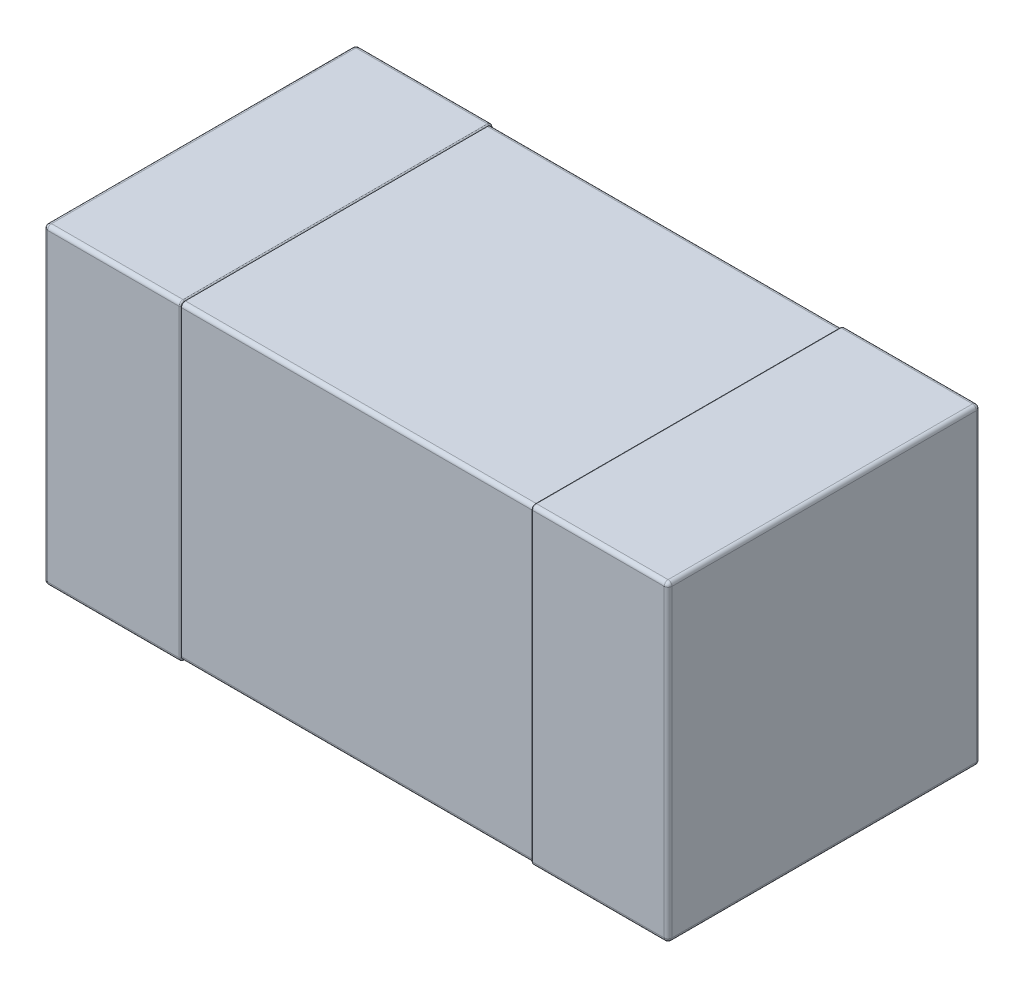
from build123d import *

# Parameters (mm, degrees)
SKETCH1_W                           = 1.6
SKETCH1_H                           = 0.8
ALL_BODY_DEPTH                      = 0.8
CUT_OUT_THE_BODY_FOR_PIN_DEPTH      = 0.45
CUT_OUT_THE_BODY_FOR_PIN_DEPTH_BACK = 0.45
SKETCH2_OUTSIDE_W                   = 3.192
SKETCH2_OUTSIDE_H                   = 3.192
SKETCH2_OUTSIDE_W_2                 = 0.794
SKETCH2_OUTSIDE_H_2                 = 0.794
BODY_FILLET_R                       = 0.01
PIN_FILLET_A_R                      = 0.01
PIN_FILLET_B_R                      = 0.003


with BuildPart() as part:
    # Sketch1 → All body (new body)
    with BuildSketch(Plane.XY):
        Rectangle(SKETCH1_W, SKETCH1_H)
    extrude(amount=ALL_BODY_DEPTH)

    # Sketch2 outside → Cut out the body for pin (cut, two sides: drawn at the far end of the back side and taken through both)
    with BuildSketch(Plane(origin=(0, 0, 0), x_dir=(0, 0, -1), z_dir=(1, 0, 0)).offset(-CUT_OUT_THE_BODY_FOR_PIN_DEPTH_BACK)):
        with Locations((-0.4, 0)):
            Rectangle(SKETCH2_OUTSIDE_W, SKETCH2_OUTSIDE_H)
        with Locations((-0.4, 0)):
            Rectangle(SKETCH2_OUTSIDE_W_2, SKETCH2_OUTSIDE_H_2, mode=Mode.SUBTRACT)
    extrude(amount=CUT_OUT_THE_BODY_FOR_PIN_DEPTH + CUT_OUT_THE_BODY_FOR_PIN_DEPTH_BACK, mode=Mode.SUBTRACT)

    # Body fillet
    body_fillet_edges = [part.edges().sort_by_distance(p)[0] for p in [
        (0, 0.397, 0.003),
        (0, 0.397, 0.797),
        (0, -0.397, 0.797),
        (0, -0.397, 0.003),
    ]]
    fillet(body_fillet_edges, radius=BODY_FILLET_R)

    # Pin fillet a
    pin_fillet_a_edges = [part.edges().sort_by_distance(p)[0] for p in [
        (0.8, 0, 0.8),
        (-0.625, 0.4, 0),
        (0.625, -0.4, 0),
        (0.625, -0.4, 0.8),
        (-0.625, 0.4, 0.8),
        (0.625, 0.4, 0.8),
        (-0.8, 0, 0.8),
        (0.625, 0.4, 0),
        (0.8, 0, 0),
        (-0.625, -0.4, 0),
        (-0.8, 0, 0),
        (-0.8, 0.4, 0.4),
        (0.8, 0.4, 0.4),
        (0.8, -0.4, 0.4),
        (-0.8, -0.4, 0.4),
        (-0.625, -0.4, 0.8),
    ]]
    fillet(pin_fillet_a_edges, radius=PIN_FILLET_A_R)

    # Pin fillet b
    pin_fillet_b_edges = [part.edges().sort_by_distance(p)[0] for p in [
        (0.45, -0.4, 0.4),
        (0.45, 0, 0.8),
        (0.45, 0.4, 0.4),
        (0.45, 0, 0),
        (-0.45, 0.4, 0.4),
        (-0.45, 0, 0.8),
        (-0.45, -0.4, 0.4),
        (-0.45, 0, 0),
        (0.45, 0.397071068, 0.002928932),
        (0.45, -0.397071068, 0.002928932),
        (0.45, -0.397071068, 0.797071068),
        (0.45, 0.397071068, 0.797071068),
        (-0.45, -0.397071068, 0.797071068),
        (-0.45, 0.397071068, 0.797071068),
        (-0.45, -0.397071068, 0.002928932),
        (-0.45, 0.397071068, 0.002928932),
    ]]
    fillet(pin_fillet_b_edges, radius=PIN_FILLET_B_R - 0.0001)  # a hair under: the kernel refuses the full size


solid = part.part
